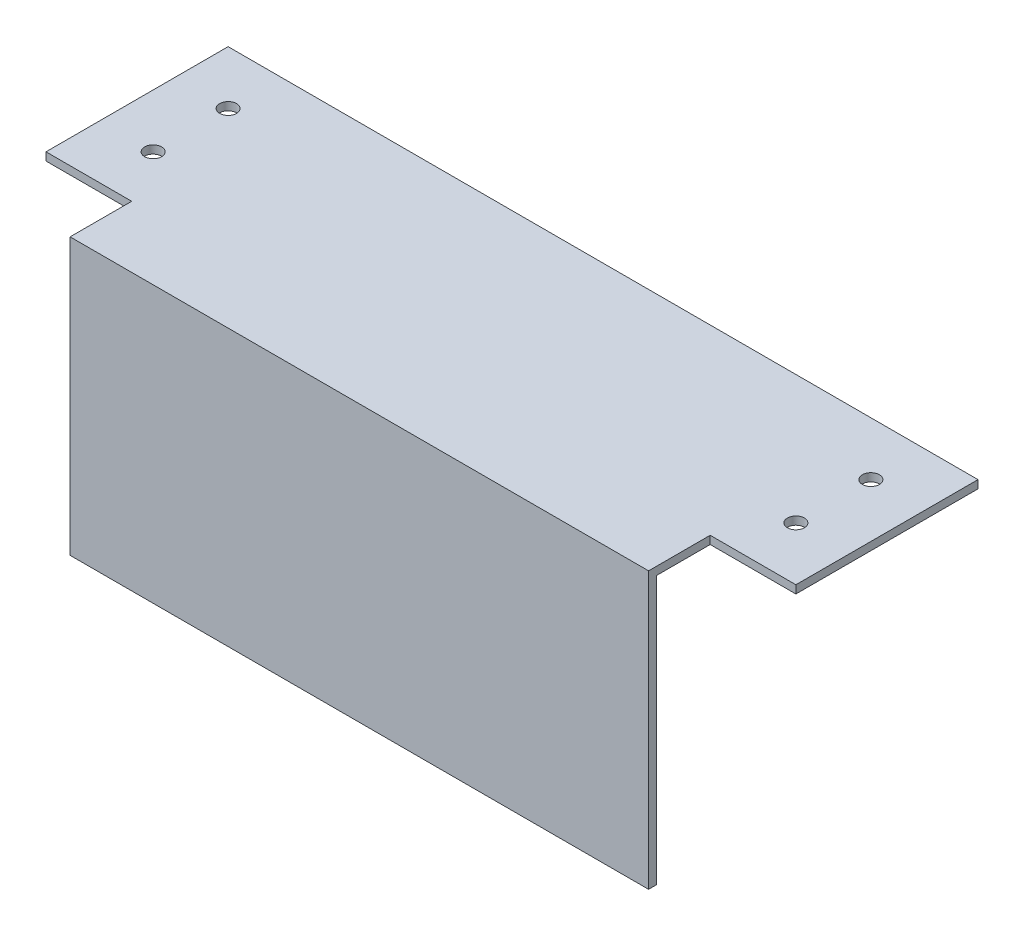
from build123d import *

# Parameters (mm, degrees)
BOSS_EXTRUDE1_OUTLINE_R = 1.5875
BOSS_EXTRUDE1_DEPTH     = 1.5
SKETCH2_W               = 108
SKETCH2_H               = 1.5
BOSS_EXTRUDE2_DEPTH     = 50


# Read off the part's stored shape, not the designer's step: Boss-Extrude1
with BuildPart() as part:
    # Boss-Extrude1 outline → Boss-Extrude1 (new body)
    with BuildSketch(Plane(origin=(0, 0, 0), x_dir=(1, 0, 0), z_dir=(0, 1, 0))):
        Polygon((84.421900247, 14.871495129), (84.421900247, 26.371495129), (100.421900247, 26.371495129), (100.421900247, 60.371495129), (-39.578099753, 60.371495129), (-39.578099753, 26.371495129), (-23.578099753, 26.371495129), (-23.578099753, 14.871495129), align=None)
        with Locations((-29.578099753, 36.371495129)):
            Circle(BOSS_EXTRUDE1_OUTLINE_R, mode=Mode.SUBTRACT)
        with Locations((90.421900247, 36.371495129)):
            Circle(BOSS_EXTRUDE1_OUTLINE_R, mode=Mode.SUBTRACT)
        with Locations((-29.578099753, 50.371495129)):
            Circle(BOSS_EXTRUDE1_OUTLINE_R, mode=Mode.SUBTRACT)
        with Locations((90.421900247, 50.371495129)):
            Circle(BOSS_EXTRUDE1_OUTLINE_R, mode=Mode.SUBTRACT)
    extrude(amount=BOSS_EXTRUDE1_DEPTH)

    # Sketch2 → Boss-Extrude2 (add)
    with BuildSketch(Plane.XZ):
        with Locations((30.421900247, -15.621495129)):
            Rectangle(SKETCH2_W, SKETCH2_H)
    extrude(amount=BOSS_EXTRUDE2_DEPTH)


solid = part.part
